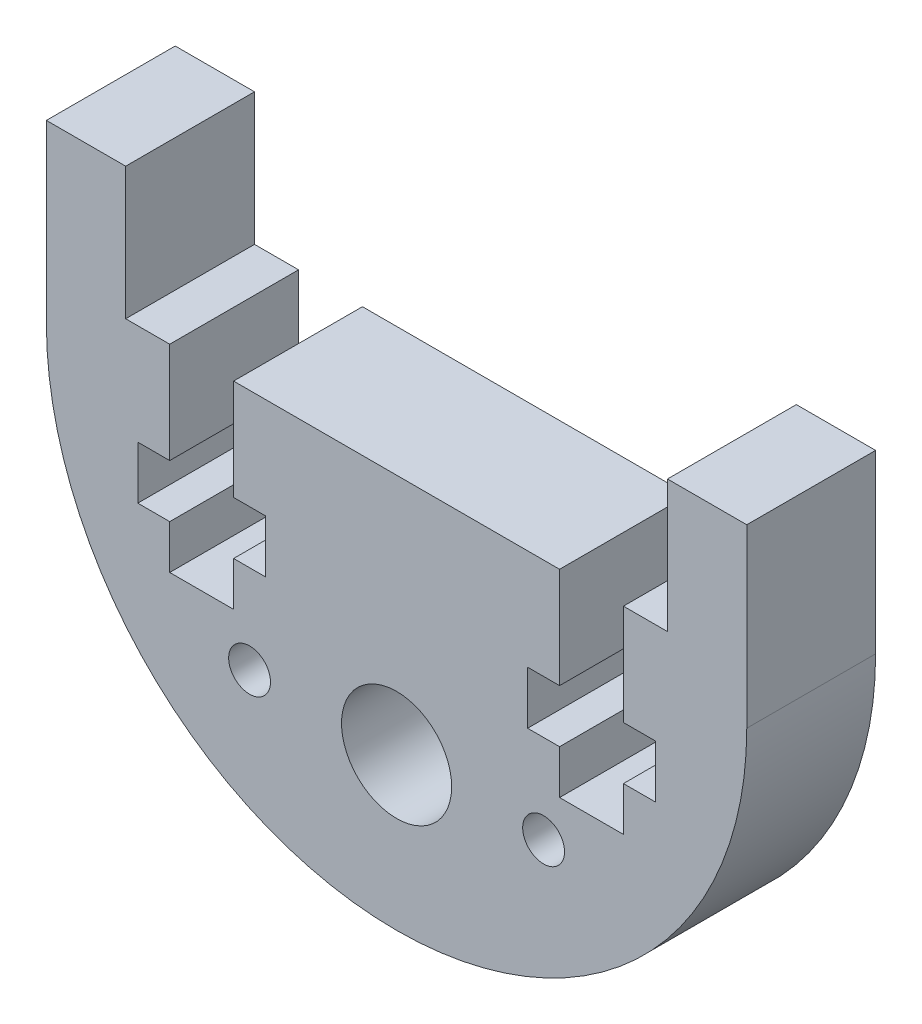
from build123d import *

# Parameters (mm, degrees)
MODEL_R             = 0.95
MODEL_R_2           = 2.5
BOSS_EXTRUDE2_DEPTH = 5.85


with BuildPart() as part:
    # Model → Boss-Extrude2 (new body)
    with BuildSketch(Plane.XY):
        with BuildLine():
            Line((553.509477136, 558.532469), (546.109477136, 558.532469))
            Line((546.109477136, 558.532469), (546.109477136, 553.956563))
            Line((546.109477136, 553.956563), (547.559477136, 553.956563))
            Line((547.559477136, 553.956563), (547.559477136, 551.556511944))
            Line((547.559477136, 551.556511944), (546.109477136, 551.556511944))
            Line((546.109477136, 551.556511944), (546.109477136, 549.556511944))
            Line((546.109477136, 549.556511944), (543.209477136, 549.556511944))
            Line((543.209477136, 549.556511944), (543.209477136, 551.556511944))
            Line((543.209477136, 551.556511944), (541.759477136, 551.556511944))
            Line((541.759477136, 551.556511944), (541.759477136, 553.956563))
            Line((541.759477136, 553.956563), (543.209477136, 553.956563))
            Line((543.209477136, 553.956563), (543.209477136, 558.532469))
            Line((543.209477136, 558.532469), (541.209477136, 558.532469))
            Line((541.209477136, 558.532469), (541.209477136, 564.532469))
            Line((541.209477136, 564.532469), (537.609477136, 564.532469))
            Line((537.609477136, 564.532469), (537.609477136, 556.532469))
            ThreePointArc((537.609477136, 556.532469), (553.509477136, 540.632469), (569.409477136, 556.532469))
            Line((569.409477136, 556.532469), (569.409477136, 564.532469))
            Line((569.409477136, 564.532469), (565.809477136, 564.532469))
            Line((565.809477136, 564.532469), (565.809477136, 558.532469))
            Line((565.809477136, 558.532469), (563.809477136, 558.532469))
            Line((563.809477136, 558.532469), (563.809477136, 553.956563))
            Line((563.809477136, 553.956563), (565.259477136, 553.956563))
            Line((565.259477136, 553.956563), (565.259477136, 551.556511944))
            Line((565.259477136, 551.556511944), (563.809477136, 551.556511944))
            Line((563.809477136, 551.556511944), (563.809477136, 549.556511944))
            Line((563.809477136, 549.556511944), (560.909477136, 549.556511944))
            Line((560.909477136, 549.556511944), (560.909477136, 551.556511944))
            Line((560.909477136, 551.556511944), (559.459477136, 551.556511944))
            Line((559.459477136, 551.556511944), (559.459477136, 553.956563))
            Line((559.459477136, 553.956563), (560.909477136, 553.956563))
            Line((560.909477136, 553.956563), (560.909477136, 558.532469))
            Line((560.909477136, 558.532469), (553.509477136, 558.532469))
        make_face()
        with Locations((546.834477136, 547.532469)):
            Circle(MODEL_R, mode=Mode.SUBTRACT)
        with Locations((553.509477136, 547.532469)):
            Circle(MODEL_R_2, mode=Mode.SUBTRACT)
        with Locations((560.184477136, 547.532469)):
            Circle(MODEL_R, mode=Mode.SUBTRACT)
    extrude(amount=BOSS_EXTRUDE2_DEPTH)


solid = part.part
